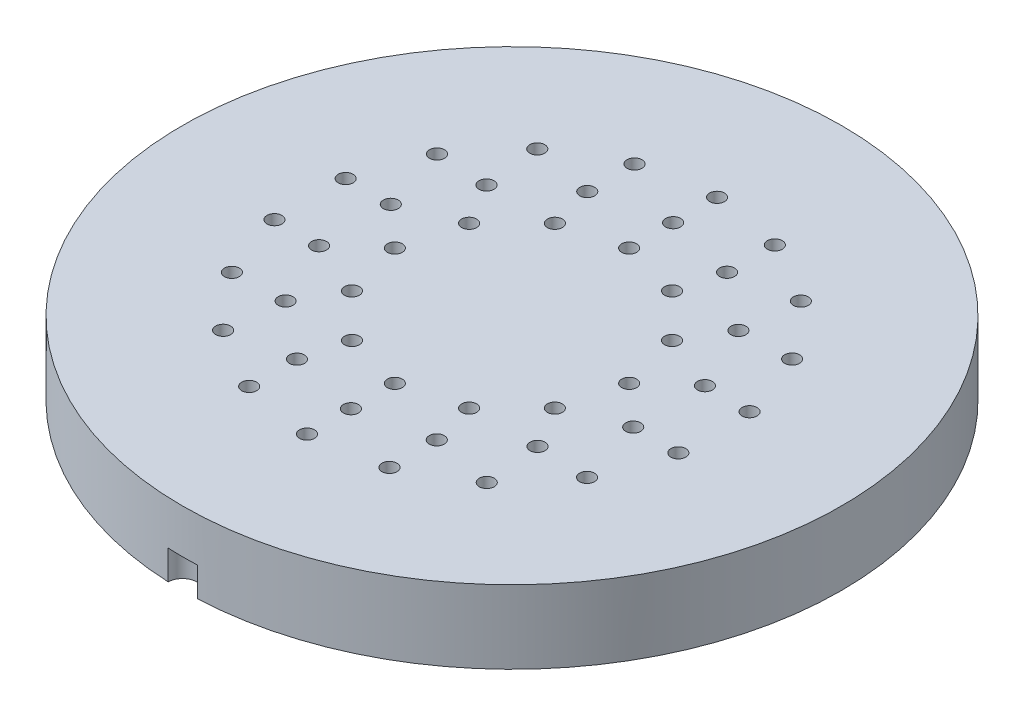
from build123d import *

# Parameters (mm, degrees)
MAIN_SHAPE_PROFILE_W    = 28.575
MAIN_SHAPE_PROFILE_H    = 6.35
DOWEL_HOLES_PROFILE_R   = 1.27
DOWEL_HOLES_DEPTH       = 2.54
F_3_8_16_TAPPED_HOLE1_D = 1.2954


with BuildPart() as part:
    # Main Shape Profile → Main Shape (revolve)
    with BuildSketch(Plane.XY):
        with Locations((14.2875, 3.175)):
            Rectangle(MAIN_SHAPE_PROFILE_W, MAIN_SHAPE_PROFILE_H)
    revolve(axis=Axis((0, 0, 0), (0, -1, 0)))

    # Dowel Holes Profile → Dowel Holes (cut)
    with BuildSketch(Plane.XZ):
        with Locations((0, 28.575)):
            Circle(DOWEL_HOLES_PROFILE_R)
        with Locations((0, -28.575)):
            Circle(DOWEL_HOLES_PROFILE_R)
    extrude(amount=-DOWEL_HOLES_DEPTH, mode=Mode.SUBTRACT)

    # 3/8-16 Tapped Hole1 (through all)
    with Locations(Plane(origin=(0, 6.35, 0), x_dir=(1, 0, 0), z_dir=(0, 1, 0))):
        with Locations((0, -10.16), (0, -13.97), (0, -17.78), (-5.08, -8.798818102), (-8.798818102, -5.08), (-10.16, 0), (-8.798818102, 5.08), (-5.08, 8.798818102), (0, 10.16), (5.08, 8.798818102), (8.798818102, 5.08), (10.16, 0), (8.798818102, -5.08), (5.08, -8.798818102), (-6.061355835, -12.586535085), (-10.92218581, -8.710152532), (-13.619742933, -3.108617447), (-13.619742933, 3.108617447), (-10.92218581, 8.710152532), (-6.061355835, 12.586535085), (0, 13.97), (6.061355835, 12.586535085), (10.92218581, 8.710152532), (13.619742933, 3.108617447), (13.619742933, -3.108617447), (10.92218581, -8.710152532), (6.061355835, -12.586535085), (-6.081118148, -16.707734798), (-11.4287637, -13.620270199), (-15.397931679, -8.89), (-17.509881849, -3.087464599), (-17.509881849, 3.087464599), (-15.397931679, 8.89), (-11.4287637, 13.620270199), (-6.081118148, 16.707734798), (0, 17.78), (6.081118148, 16.707734798), (11.4287637, 13.620270199), (15.397931679, 8.89), (17.509881849, 3.087464599), (17.509881849, -3.087464599), (15.397931679, -8.89), (11.4287637, -13.620270199), (6.081118148, -16.707734798)):
            Hole(F_3_8_16_TAPPED_HOLE1_D / 2)


solid = part.part
